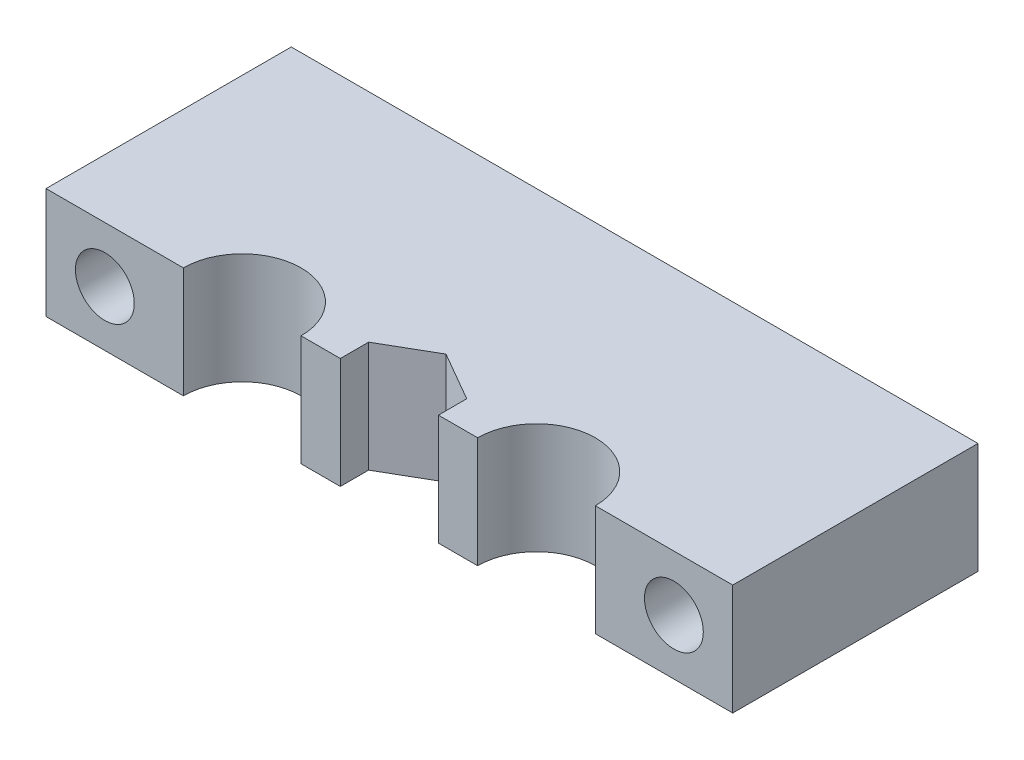
from build123d import *

# Parameters (mm, degrees)
BOSS_EXTRUDE1_DEPTH = 11.3
SKETCH2_R           = 3
CUT_EXTRUDE1_DEPTH  = 76.184373376


with BuildPart() as part:
    # Sketch1 → Boss-Extrude1 (new body)
    with BuildSketch(Plane(origin=(0, 0, 0), x_dir=(1, 0, 0), z_dir=(0, 1, 0))):
        with BuildLine():
            Line((56, 0), (70, 0))
            Line((70, 0), (70, 25))
            Line((70, 25), (0, 25))
            Line((0, 25), (0, 0))
            Line((0, 0), (14, 0))
            ThreePointArc((14, 0), (20, 6), (26, 0))
            Line((26, 0), (30, 0))
            Line((30, 0), (30, 2.886751346))
            Line((30, 2.886751346), (35, 5.773502692))
            Line((35, 5.773502692), (40, 2.886751346))
            Line((40, 2.886751346), (40, 0))
            Line((40, 0), (44, 0))
            ThreePointArc((44, 0), (50, 6), (56, 0))
        make_face()
    extrude(amount=BOSS_EXTRUDE1_DEPTH)

    # Sketch2 → Cut-Extrude1 (cut, through all)
    with BuildSketch(Plane(origin=(0, 0, -25), x_dir=(-1, 0, 0), z_dir=(0, 0, -1))):
        with Locations((-6, 5.65)):
            Circle(SKETCH2_R)
        with Locations((-64, 5.65)):
            Circle(SKETCH2_R)
    extrude(amount=-CUT_EXTRUDE1_DEPTH, mode=Mode.SUBTRACT)


solid = part.part
